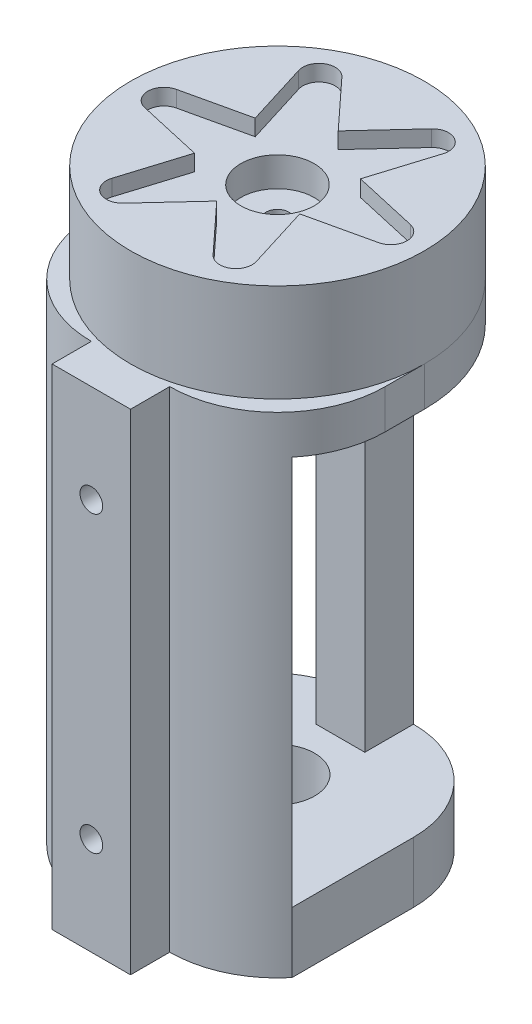
from build123d import *

# Parameters (mm, degrees)
SKETCH1_R               = 19.05
BOSS_EXTRUDE1_DEPTH     = 76.2
CAVITY1_START           = 74.1
CAVITY1_OUTLINE_R       = 1.05
CAVITY1_OUTLINE_R_2     = 4.4625
CAVITY1_DEPTH           = 2.1
CAVITY1_START_2         = 71.1599999
CAVITY1_2_OUTLINE_R     = 4.4625
CAVITY1_2_OUTLINE_R_2   = 3.15
CAVITY1_2_DEPTH         = 4.7775
CAVITY1_3_OUTLINE_R     = 3.15
CAVITY1_3_OUTLINE_R_2   = 1.785
CAVITY1_3_DEPTH         = 1.05
CAVITY1_START_3         = 70.95
CAVITY1_4_DEPTH         = 3.15
CUT_EXTRUDE1_DEPTH      = 5.08
CUT_EXTRUDE1_DEPTH_BACK = 3.81
SKETCH2_R               = 4.75
SKETCH4_W               = 8.715142414
SKETCH4_H               = 2.720359939
CUT_EXTRUDE2_DEPTH      = 2.1
SKETCH5_R               = 19.05
CUT_EXTRUDE3_DEPTH      = 63.5
SKETCH8_W               = 38.1
SKETCH8_H               = 38.1
BOSS_EXTRUDE2_DEPTH     = 63.5
SKETCH9_W               = 33.02
SKETCH9_H               = 58.42
CUT_EXTRUDE4_DEPTH      = 42.672
FILLET1_R               = 19.05
FILLET2_R               = 13.97
SKETCH11_W              = 10.16
SKETCH11_H              = 63.5
BOSS_EXTRUDE3_DEPTH     = 5.08
SKETCH12_R              = 1.4732
CUT_EXTRUDE5_DEPTH      = 10.668
SKETCH13_R              = 1.4732
CUT_EXTRUDE6_DEPTH      = 20.32
SKETCH14_W              = 31.71261469
SKETCH14_H              = 7.874
BOSS_EXTRUDE4_DEPTH     = 28.448
FILLET3_R               = 12.7
SKETCH15_R              = 4.8133
CUT_EXTRUDE7_DEPTH      = 28.448
SKETCH16_W              = 2.261133912
SKETCH16_H              = 1.481432563
SKETCH16_W_2            = 1.871283238
SKETCH16_H_2            = 2.027223507
SKETCH16_W_3            = 2.027223508
SKETCH16_H_3            = 2.222148845
SKETCH16_W_4            = 12.670146923
SKETCH16_H_4            = 11.890445574
SKETCH16_W_5            = 1.793313103
SKETCH16_W_6            = 2.30011898
SKETCH16_H_5            = 1.793313103
SKETCH16_H_6            = 1.520417631
CUT_EXTRUDE8_DEPTH      = 2.1
SKETCH17_W              = 6.31261469
SKETCH17_H              = 6.312614691
BOSS_EXTRUDE5_DEPTH     = 50.546


with BuildPart() as part:
    # Sketch1 → Boss-Extrude1 (new body)
    with BuildSketch(Plane(origin=(0, 0, 0), x_dir=(1, 0, 0), z_dir=(0, 1, 0))):
        with Locations(Location((0, 0, 0), (0, 0, 90))):
            Circle(SKETCH1_R)
    extrude(amount=BOSS_EXTRUDE1_DEPTH)

    # Cavity1: read off the stored shape, not the designer's step
    # Cavity1 outline → Cavity1 (cut)
    with BuildSketch(Plane(origin=(0, 0, 0), x_dir=(1, 0, 0), z_dir=(0, 1, 0)).offset(CAVITY1_START)):
        with BuildLine():
            ThreePointArc((5.80813996, -14.156289963), (8.4, -14.549226784), (9.355636751, -12.108141735))
            Line((9.355636751, -12.108141735), (6.819950055, -3.9375))
            Line((6.819950055, -3.9375), (15.163776711, -2.048148228))
            ThreePointArc((15.163776711, -2.048148228), (16.8, 0), (15.163776711, 2.048148228))
            Line((15.163776711, 2.048148228), (6.819950055, 3.9375))
            Line((6.819950055, 3.9375), (9.355636751, 12.108141735))
            ThreePointArc((9.355636751, 12.108141735), (8.4, 14.549226784), (5.80813996, 14.156289963))
            Line((5.80813996, 14.156289963), (0, 7.875))
            Line((0, 7.875), (-5.80813996, 14.156289963))
            ThreePointArc((-5.80813996, 14.156289963), (-8.4, 14.549226784), (-9.355636751, 12.108141735))
            Line((-9.355636751, 12.108141735), (-6.819950055, 3.9375))
            Line((-6.819950055, 3.9375), (-15.163776711, 2.048148228))
            ThreePointArc((-15.163776711, 2.048148228), (-16.8, 0), (-15.163776711, -2.048148228))
            Line((-15.163776711, -2.048148228), (-6.819950055, -3.9375))
            Line((-6.819950055, -3.9375), (-9.355636751, -12.108141735))
            ThreePointArc((-9.355636751, -12.108141735), (-8.4, -14.549226784), (-5.80813996, -14.156289963))
            Line((-5.80813996, -14.156289963), (0, -7.875))
            Line((0, -7.875), (5.80813996, -14.156289963))
        make_face()
        with Locations((-7.0875, -12.275910099)):
            Circle(CAVITY1_OUTLINE_R, mode=Mode.SUBTRACT)
        with Locations((-5.5125, -9.547930077)):
            Circle(CAVITY1_OUTLINE_R, mode=Mode.SUBTRACT)
        with Locations((-3.9375, -6.819950055)):
            Circle(CAVITY1_OUTLINE_R, mode=Mode.SUBTRACT)
        with Locations((7.0875, -12.275910099)):
            Circle(CAVITY1_OUTLINE_R, mode=Mode.SUBTRACT)
        with Locations((5.5125, -9.547930077)):
            Circle(CAVITY1_OUTLINE_R, mode=Mode.SUBTRACT)
        with Locations((3.9375, -6.819950055)):
            Circle(CAVITY1_OUTLINE_R, mode=Mode.SUBTRACT)
        with Locations((-14.175, 0)):
            Circle(CAVITY1_OUTLINE_R, mode=Mode.SUBTRACT)
        with Locations((-11.025, 0)):
            Circle(CAVITY1_OUTLINE_R, mode=Mode.SUBTRACT)
        with Locations((-7.875, 0)):
            Circle(CAVITY1_OUTLINE_R, mode=Mode.SUBTRACT)
        with Locations((-3.9375, 6.819950055)):
            Circle(CAVITY1_OUTLINE_R, mode=Mode.SUBTRACT)
        with Locations((-5.5125, 9.547930077)):
            Circle(CAVITY1_OUTLINE_R, mode=Mode.SUBTRACT)
        with Locations((-7.0875, 12.275910099)):
            Circle(CAVITY1_OUTLINE_R, mode=Mode.SUBTRACT)
        Circle(CAVITY1_OUTLINE_R_2, mode=Mode.SUBTRACT)
        with Locations((7.875, 0)):
            Circle(CAVITY1_OUTLINE_R, mode=Mode.SUBTRACT)
        with Locations((3.9375, 6.819950055)):
            Circle(CAVITY1_OUTLINE_R, mode=Mode.SUBTRACT)
        with Locations((11.025, 0)):
            Circle(CAVITY1_OUTLINE_R, mode=Mode.SUBTRACT)
        with Locations((14.175, 0)):
            Circle(CAVITY1_OUTLINE_R, mode=Mode.SUBTRACT)
        with Locations((5.5125, 9.547930077)):
            Circle(CAVITY1_OUTLINE_R, mode=Mode.SUBTRACT)
        with Locations((7.0875, 12.275910099)):
            Circle(CAVITY1_OUTLINE_R, mode=Mode.SUBTRACT)
    extrude(amount=CAVITY1_DEPTH, mode=Mode.SUBTRACT)

    # Cavity1 2 outline → Cavity1 2 (cut)
    with BuildSketch(Plane(origin=(0, 0, 0), x_dir=(1, 0, 0), z_dir=(0, 1, 0)).offset(CAVITY1_START_2)):
        Circle(CAVITY1_2_OUTLINE_R)
        Circle(CAVITY1_2_OUTLINE_R_2, mode=Mode.SUBTRACT)
    extrude(amount=CAVITY1_2_DEPTH, mode=Mode.SUBTRACT)

    # Cavity1 3 outline → Cavity1 3 (cut)
    with BuildSketch(Plane(origin=(0, 0, 0), x_dir=(1, 0, 0), z_dir=(0, 1, 0)).offset(CAVITY1_START)):
        Circle(CAVITY1_3_OUTLINE_R)
        Circle(CAVITY1_3_OUTLINE_R_2, mode=Mode.SUBTRACT)
    extrude(amount=CAVITY1_3_DEPTH, mode=Mode.SUBTRACT)

    # Cavity1 4 outline → Cavity1 4 (cut)
    with BuildSketch(Plane(origin=(0, 0, 0), x_dir=(1, 0, 0), z_dir=(0, 1, 0)).offset(CAVITY1_START_3)):
        with BuildLine():
            ThreePointArc((3.135298976, -0.303974232), (3.15, 0), (3.135298976, 0.303974232))
            Line((3.135298976, 0.303974232), (2.73, 0))
            Line((2.73, 0), (3.135298976, -0.303974232))
        make_face()
        with BuildLine():
            Line((2.636977506, 0.706575993), (3.107140574, 0.517858526))
            ThreePointArc((3.107140574, 0.517858526), (3.042666353, 0.815279992), (2.949791933, 1.105091648))
            Line((2.949791933, 1.105091648), (2.636977506, 0.706575993))
        make_face()
        with BuildLine():
            ThreePointArc((2.949791933, -1.105091648), (3.042666353, -0.815279992), (3.107140574, -0.517858526))
            Line((3.107140574, -0.517858526), (2.636977506, -0.706575993))
            Line((2.636977506, -0.706575993), (2.949791933, -1.105091648))
        make_face()
        with BuildLine():
            Line((2.364249352, 1.365), (2.867235677, 1.304400081))
            ThreePointArc((2.867235677, 1.304400081), (2.727980022, 1.575), (2.563261445, 1.830898895))
            Line((2.563261445, 1.830898895), (2.364249352, 1.365))
        make_face()
        with BuildLine():
            ThreePointArc((2.563261445, -1.830898895), (2.727980022, -1.575), (2.867235677, -1.304400081))
            Line((2.867235677, -1.304400081), (2.364249352, -1.365))
            Line((2.364249352, -1.365), (2.563261445, -1.830898895))
        make_face()
        with BuildLine():
            Line((1.930401513, 1.930401513), (2.431933407, 2.002048926))
            ThreePointArc((2.431933407, 2.002048926), (2.227386361, 2.227386361), (2.002048926, 2.431933407))
            Line((2.002048926, 2.431933407), (1.930401513, 1.930401513))
        make_face()
        with BuildLine():
            ThreePointArc((2.002048926, -2.431933407), (2.227386361, -2.227386361), (2.431933407, -2.002048926))
            Line((2.431933407, -2.002048926), (1.930401513, -1.930401513))
            Line((1.930401513, -1.930401513), (2.002048926, -2.431933407))
        make_face()
        with BuildLine():
            Line((1.365, 2.364249352), (1.830898895, 2.563261445))
            ThreePointArc((1.830898895, 2.563261445), (1.575, 2.727980022), (1.304400081, 2.867235677))
            Line((1.304400081, 2.867235677), (1.365, 2.364249352))
        make_face()
        with BuildLine():
            ThreePointArc((1.304400081, -2.867235677), (1.575, -2.727980022), (1.830898895, -2.563261445))
            Line((1.830898895, -2.563261445), (1.365, -2.364249352))
            Line((1.365, -2.364249352), (1.304400081, -2.867235677))
        make_face()
        with BuildLine():
            Line((0.706575993, 2.636977506), (1.105091648, 2.949791933))
            ThreePointArc((1.105091648, 2.949791933), (0.815279992, 3.042666353), (0.517858526, 3.107140574))
            Line((0.517858526, 3.107140574), (0.706575993, 2.636977506))
        make_face()
        with BuildLine():
            ThreePointArc((0.517858526, -3.107140574), (0.815279992, -3.042666353), (1.105091648, -2.949791933))
            Line((1.105091648, -2.949791933), (0.706575993, -2.636977506))
            Line((0.706575993, -2.636977506), (0.517858526, -3.107140574))
        make_face()
        with BuildLine():
            Line((0, 2.73), (0.303974232, 3.135298976))
            ThreePointArc((0.303974232, 3.135298976), (0, 3.15), (-0.303974232, 3.135298976))
            Line((-0.303974232, 3.135298976), (0, 2.73))
        make_face()
        with BuildLine():
            ThreePointArc((-0.303974232, -3.135298976), (0, -3.15), (0.303974232, -3.135298976))
            Line((0.303974232, -3.135298976), (0, -2.73))
            Line((0, -2.73), (-0.303974232, -3.135298976))
        make_face()
        with BuildLine():
            Line((-0.706575993, 2.636977506), (-0.517858526, 3.107140574))
            ThreePointArc((-0.517858526, 3.107140574), (-0.815279992, 3.042666353), (-1.105091648, 2.949791933))
            Line((-1.105091648, 2.949791933), (-0.706575993, 2.636977506))
        make_face()
        with BuildLine():
            ThreePointArc((-1.105091648, -2.949791933), (-0.815279992, -3.042666353), (-0.517858526, -3.107140574))
            Line((-0.517858526, -3.107140574), (-0.706575993, -2.636977506))
            Line((-0.706575993, -2.636977506), (-1.105091648, -2.949791933))
        make_face()
        with BuildLine():
            Line((-1.365, 2.364249352), (-1.304400081, 2.867235677))
            ThreePointArc((-1.304400081, 2.867235677), (-1.575, 2.727980022), (-1.830898895, 2.563261445))
            Line((-1.830898895, 2.563261445), (-1.365, 2.364249352))
        make_face()
        with BuildLine():
            ThreePointArc((-1.830898895, -2.563261445), (-1.575, -2.727980022), (-1.304400081, -2.867235677))
            Line((-1.304400081, -2.867235677), (-1.365, -2.364249352))
            Line((-1.365, -2.364249352), (-1.830898895, -2.563261445))
        make_face()
        with BuildLine():
            Line((-1.930401513, 1.930401513), (-2.002048926, 2.431933407))
            ThreePointArc((-2.002048926, 2.431933407), (-2.227386361, 2.227386361), (-2.431933407, 2.002048926))
            Line((-2.431933407, 2.002048926), (-1.930401513, 1.930401513))
        make_face()
        with BuildLine():
            ThreePointArc((-2.431933407, -2.002048926), (-2.227386361, -2.227386361), (-2.002048926, -2.431933407))
            Line((-2.002048926, -2.431933407), (-1.930401513, -1.930401513))
            Line((-1.930401513, -1.930401513), (-2.431933407, -2.002048926))
        make_face()
        with BuildLine():
            Line((-2.364249352, 1.365), (-2.563261445, 1.830898895))
            ThreePointArc((-2.563261445, 1.830898895), (-2.727980022, 1.575), (-2.867235677, 1.304400081))
            Line((-2.867235677, 1.304400081), (-2.364249352, 1.365))
        make_face()
        with BuildLine():
            ThreePointArc((-2.867235677, -1.304400081), (-2.727980022, -1.575), (-2.563261445, -1.830898895))
            Line((-2.563261445, -1.830898895), (-2.364249352, -1.365))
            Line((-2.364249352, -1.365), (-2.867235677, -1.304400081))
        make_face()
        with BuildLine():
            Line((-2.636977506, 0.706575993), (-2.949791933, 1.105091648))
            ThreePointArc((-2.949791933, 1.105091648), (-3.042666353, 0.815279992), (-3.107140574, 0.517858526))
            Line((-3.107140574, 0.517858526), (-2.636977506, 0.706575993))
        make_face()
        with BuildLine():
            ThreePointArc((-3.107140574, -0.517858526), (-3.042666353, -0.815279992), (-2.949791933, -1.105091648))
            Line((-2.949791933, -1.105091648), (-2.636977506, -0.706575993))
            Line((-2.636977506, -0.706575993), (-3.107140574, -0.517858526))
        make_face()
        with BuildLine():
            Line((-2.73, 0), (-3.135298976, 0.303974232))
            ThreePointArc((-3.135298976, 0.303974232), (-3.15, 0), (-3.135298976, -0.303974232))
            Line((-3.135298976, -0.303974232), (-2.73, 0))
        make_face()
    extrude(amount=CAVITY1_4_DEPTH, mode=Mode.SUBTRACT)

    # Cavity1 5 outline → Cavity1 5 (revolve, cut)
    with BuildSketch(Plane.XY):
        with BuildLine():
            Line((3.15, 75.9375), (4.4625, 75.9374999))
            Line((4.4625, 75.9374999), (4.4625, 76.2))
            Line((4.4625, 76.2), (3.4125, 76.2))
            ThreePointArc((3.4125, 76.2), (3.22688447, 76.12311553), (3.15, 75.9375))
        make_face()
        with BuildLine():
            Line((3.15, 70.95), (4.2525, 70.95))
            ThreePointArc((4.2525, 70.95), (4.400992424, 71.011507576), (4.4625, 71.16))
            Line((4.4625, 71.16), (3.15, 71.1599999))
            Line((3.15, 71.1599999), (3.15, 70.95))
        make_face()
    revolve(axis=Axis((0, 0, 0), (0, 1, 0)), mode=Mode.SUBTRACT)


with BuildPart() as body_2:
    # Cavity1 6 outline → Cavity1 6 (revolve)
    with BuildSketch(Plane.XY):
        with BuildLine():
            ThreePointArc((3.4125, 76.2), (3.59811553, 76.12311553), (3.675, 75.9375))
            Line((3.675, 75.9375), (3.675, 75.15))
            Line((3.675, 75.15), (4.725, 75.15))
            Line((4.725, 75.15), (4.725, 75.9375))
            ThreePointArc((4.725, 75.9375), (4.80188447, 76.12311553), (4.9875, 76.2))
            Line((4.9875, 76.2), (3.4125, 76.2))
        make_face()
    revolve(axis=Axis((0, 0, 0), (0, 1, 0)))


with BuildPart() as cut_extrude1_tool:
    # Sketch2 → Cut-Extrude1 (new, two sides: drawn at the far end of the back side and taken through both)
    with BuildSketch(Plane(origin=(0, 74.1, 0), x_dir=(1, 0, 0), z_dir=(0, 1, 0)).offset(-CUT_EXTRUDE1_DEPTH_BACK)):
        Circle(SKETCH2_R)
    extrude(amount=CUT_EXTRUDE1_DEPTH + CUT_EXTRUDE1_DEPTH_BACK)


with BuildPart() as part_1:
    add(part.part)

    # Cut-Extrude1: cut by cut_extrude1_tool
    add(cut_extrude1_tool.part, mode=Mode.SUBTRACT)

    # Sketch4 → Cut-Extrude2 (cut)
    with BuildSketch(Plane(origin=(0, 76.2, 0), x_dir=(1, 0, 0), z_dir=(0, 1, 0))):
        Polygon((1.823455226, -5.611970264), (6.088368584, -13.454724965), (8.574108094, -12.102972418), (4.427174762, -4.477171338), align=None)
        with Locations((10.445939791, -0.057681561)):
            Rectangle(SKETCH4_W, SKETCH4_H)
        Polygon((-1.774869218, -6.007839079), (-6.011321946, -13.087622733), (-8.632108857, -12.464519484), (-4.772101225, -4.214333468), align=None)
        Polygon((-6.011321946, 1.774023268), (-6.011321946, -1.972920099), (-14.424619624, -1.417861531), (-14.929825471, 1.302498408), (-12.950446355, 1.670094581), align=None)
        Polygon((-1.457669544, 5.89987102), (-5.07831145, 4.636856402), (-8.632108857, 12.299145085), (-6.011321946, 13.514675603), align=None)
        Polygon((4.773202572, 4.636856402), (0.880986898, 6.010579581), (6.537597068, 13.703234469), (8.44707549, 12.299145085), align=None)
    extrude(amount=-CUT_EXTRUDE2_DEPTH, mode=Mode.SUBTRACT)

    # Sketch5 → Cut-Extrude3 (cut)
    with BuildSketch(Plane.XZ):
        with Locations(Location((0, 0, 0), (0, 0, 270))):
            Circle(SKETCH5_R)
    extrude(amount=-CUT_EXTRUDE3_DEPTH, mode=Mode.SUBTRACT)

    # Sketch8 → Boss-Extrude2 (add)
    with BuildSketch(Plane.XZ.offset(-63.5)):
        Rectangle(SKETCH8_W, SKETCH8_H)
    extrude(amount=BOSS_EXTRUDE2_DEPTH)

    # Sketch9 → Cut-Extrude4 (cut)
    with BuildSketch(Plane(origin=(19.05, 0, 0), x_dir=(0, 0, -1), z_dir=(1, 0, 0))):
        with Locations((2.54, 29.21)):
            Rectangle(SKETCH9_W, SKETCH9_H)
    extrude(amount=-CUT_EXTRUDE4_DEPTH, mode=Mode.SUBTRACT)

    # Fillet1
    fillet1_edges = [part_1.edges().sort_by_distance(p)[0] for p in [
        (19.05, 60.96, -19.05),
        (-19.05, 60.96, -19.05),
    ]]
    fillet(fillet1_edges, radius=FILLET1_R - 0.0001)  # a hair under: the kernel refuses the full size

    # Fillet2
    fillet2_edges = [part_1.edges().sort_by_distance(p)[0] for p in [
        (-19.05, 31.75, 19.05),
        (19.05, 31.75, 19.05),
    ]]
    fillet(fillet2_edges, radius=FILLET2_R)

    # Sketch11 → Boss-Extrude3 (add)
    with BuildSketch(Plane.XY.offset(19.05)):
        with Locations((0, 31.75)):
            Rectangle(SKETCH11_W, SKETCH11_H)
    extrude(amount=BOSS_EXTRUDE3_DEPTH)

    # Sketch12 → Cut-Extrude5 (cut)
    with BuildSketch(Plane.XY.offset(24.13)):
        with Locations((0, 50.8)):
            Circle(SKETCH12_R)
        with Locations((0, 12.7)):
            Circle(SKETCH12_R)
    extrude(amount=-CUT_EXTRUDE5_DEPTH, mode=Mode.SUBTRACT)

    # Sketch13 → Cut-Extrude6 (cut)
    with BuildSketch(Plane.XZ.offset(-58.42)):
        with Locations(Location((0, 0, 0), (0, 0, 270))):
            Circle(SKETCH13_R)
    extrude(amount=-CUT_EXTRUDE6_DEPTH, mode=Mode.SUBTRACT)

    # Sketch14 → Boss-Extrude4 (add)
    with BuildSketch(Plane(origin=(0, 0, 13.97), x_dir=(-1, 0, 0), z_dir=(0, 0, -1))):
        with Locations((0, 3.937)):
            Rectangle(SKETCH14_W, SKETCH14_H)
    extrude(amount=BOSS_EXTRUDE4_DEPTH)

    # Fillet3
    fillet3_edges = [part_1.edges().sort_by_distance(p)[0] for p in [
        (15.856307345, 3.937, -14.478),
        (-15.856307345, 3.937, -14.478),
    ]]
    fillet(fillet3_edges, radius=FILLET3_R)

    # Sketch15 → Cut-Extrude7 (cut)
    with BuildSketch(Plane.XZ):
        with Locations(Location((0, 0, 0), (0, 0, 270))):
            Circle(SKETCH15_R)
    extrude(amount=-CUT_EXTRUDE7_DEPTH, mode=Mode.SUBTRACT)


with BuildPart() as body_2_1:
    add(body_2.part)

    # Cut-Extrude1: cut by cut_extrude1_tool
    add(cut_extrude1_tool.part, mode=Mode.SUBTRACT)


with BuildPart() as cut_extrude8_tool:
    # Sketch16 → Cut-Extrude8 (new body)
    with BuildSketch(Plane(origin=(0, 74.1, 0), x_dir=(1, 0, 0), z_dir=(0, 1, 0))):
        with Locations((-7.269758387, 12.831380038)):
            Rectangle(SKETCH16_W, SKETCH16_H)
        with Locations((7.622537381, 12.558484566)):
            Rectangle(SKETCH16_W_2, SKETCH16_H_2)
        with Locations((-14.715906271, -0.131154891)):
            Rectangle(SKETCH16_W_3, SKETCH16_H_3)
        with Locations((-0.077013442, 0.60956139)):
            Rectangle(SKETCH16_W_4, SKETCH16_H_4)
        with Locations((15.029700198, -0.131154891)):
            Rectangle(SKETCH16_W_5, SKETCH16_H_3)
        with Locations((7.40811951, -12.664854078)):
            Rectangle(SKETCH16_W_6, SKETCH16_H_5)
        with Locations((-7.269758387, -12.801301815)):
            Rectangle(SKETCH16_W, SKETCH16_H_6)
    extrude(amount=CUT_EXTRUDE8_DEPTH)


with BuildPart() as part_2:
    add(part_1.part)

    # Cut-Extrude8: cut by cut_extrude8_tool
    add(cut_extrude8_tool.part, mode=Mode.SUBTRACT)

    # Sketch17 → Boss-Extrude5 (add)
    with BuildSketch(Plane(origin=(0, 7.874, 0), x_dir=(1, 0, 0), z_dir=(0, 1, 0))):
        with Locations((0, 11.321692655)):
            Rectangle(SKETCH17_W, SKETCH17_H)
    extrude(amount=BOSS_EXTRUDE5_DEPTH)


with BuildPart() as body_2_2:
    add(body_2_1.part)

    # Cut-Extrude8: cut by cut_extrude8_tool
    add(cut_extrude8_tool.part, mode=Mode.SUBTRACT)


solid = part_2.part
